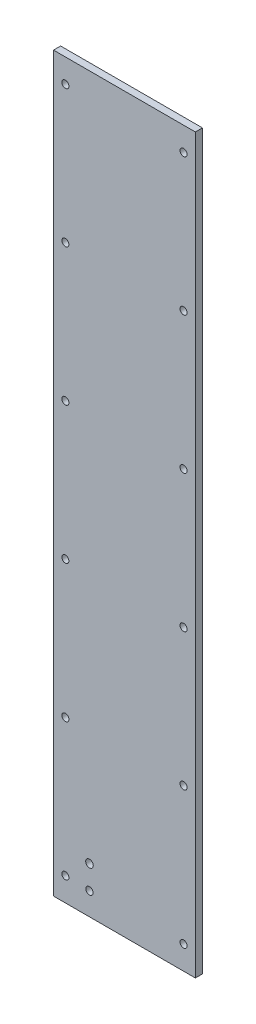
from build123d import *

# Parameters (mm, degrees)
ESQUISSE1_R        = 1.5
ESQUISSE1_R_2      = 1.55
ESQUISSE1_R_3      = 1.6
BOSS_EXTRU_1_DEPTH = 3


with BuildPart() as part:
    # Esquisse1 → Boss.-Extru.1 (new body)
    with BuildSketch(Plane.XY):
        Polygon((-20, -155), (30, -155), (30, 155), (-20, 155), (-30, 155), (-30, 150), (-30, -150), (-30, -155), align=None)
        with Locations((-25, -145)):
            Circle(ESQUISSE1_R, mode=Mode.SUBTRACT)
        with Locations((-25, -87)):
            Circle(ESQUISSE1_R, mode=Mode.SUBTRACT)
        with Locations((-14.8, -145.455320997)):
            Circle(ESQUISSE1_R_2, mode=Mode.SUBTRACT)
        with Locations((-14.8, -135.455320997)):
            Circle(ESQUISSE1_R_3, mode=Mode.SUBTRACT)
        with Locations((-25, -29)):
            Circle(ESQUISSE1_R, mode=Mode.SUBTRACT)
        with Locations((25, -145)):
            Circle(ESQUISSE1_R, mode=Mode.SUBTRACT)
        with Locations((25, -87)):
            Circle(ESQUISSE1_R, mode=Mode.SUBTRACT)
        with Locations((25, -29)):
            Circle(ESQUISSE1_R, mode=Mode.SUBTRACT)
        with Locations((-25, 29)):
            Circle(ESQUISSE1_R, mode=Mode.SUBTRACT)
        with Locations((-25, 87)):
            Circle(ESQUISSE1_R, mode=Mode.SUBTRACT)
        with Locations((-25, 145)):
            Circle(ESQUISSE1_R, mode=Mode.SUBTRACT)
        with Locations((25, 29)):
            Circle(ESQUISSE1_R, mode=Mode.SUBTRACT)
        with Locations((25, 87)):
            Circle(ESQUISSE1_R, mode=Mode.SUBTRACT)
        with Locations((25, 145)):
            Circle(ESQUISSE1_R, mode=Mode.SUBTRACT)
    extrude(amount=BOSS_EXTRU_1_DEPTH)


solid = part.part
